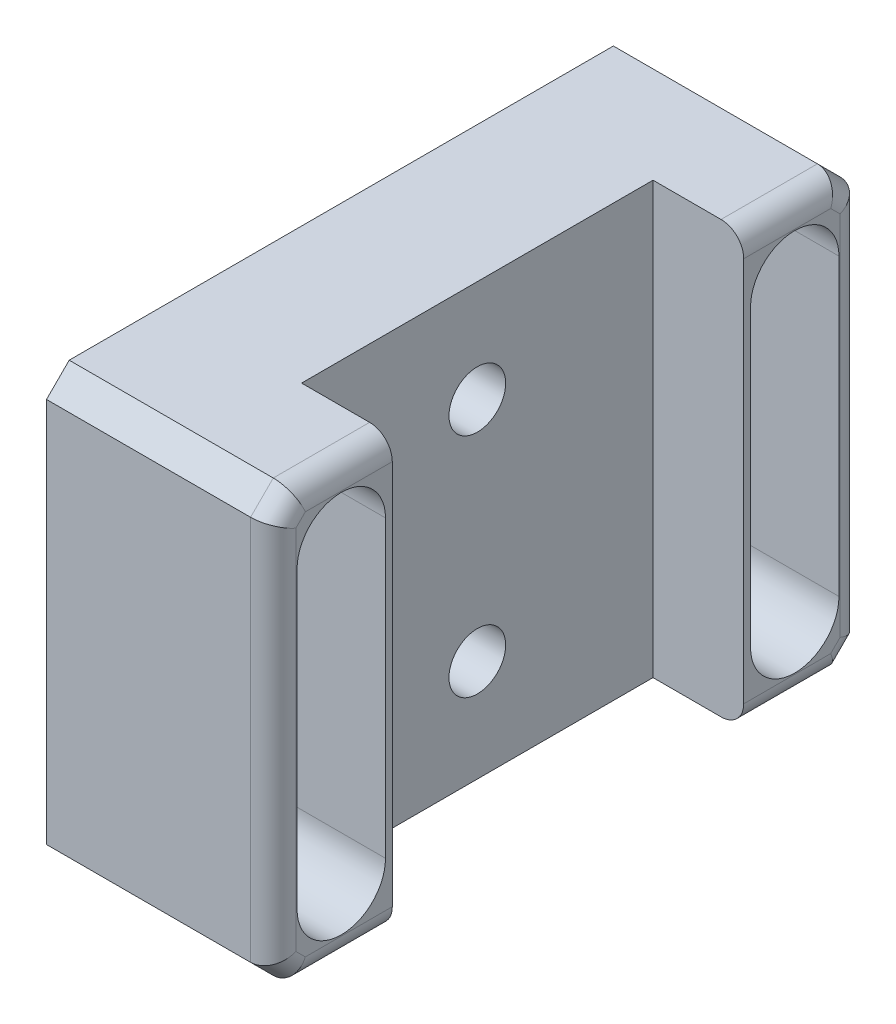
from build123d import *

# Parameters (mm, degrees)
SKETCH_1_W          = 26
SKETCH_1_H          = 19
EXTRUDE_1_DEPTH     = 10
SKETCH_2_W          = 15.5
SKETCH_2_H          = 19
CUT_EXTRUDE_1_DEPTH = 4
CUT_EXTRUDE_2_DEPTH = 4
CHAMFER_1_SIZE      = 1
FILLET_1_R          = 1
SKETCH_4_R          = 1.25
CUT_EXTRUDE_3_DEPTH = 18.182840277
CUT_EXTRUDE_4_DEPTH = 3


with BuildPart() as part:
    # Эскиз1 → Бобышка-Вытянуть1 (new body)
    with BuildSketch(Plane(origin=(0, 0, 0), x_dir=(0, 0, -1), z_dir=(1, 0, 0))):
        Rectangle(SKETCH_1_W, SKETCH_1_H)
        with BuildLine():
            Line((-8.75, 6.5), (-8.75, -6.5))
            ThreePointArc((-8.75, -6.5), (-10, -7.75), (-11.25, -6.5))
            Line((-11.25, -6.5), (-11.25, 6.5))
            ThreePointArc((-11.25, 6.5), (-10, 7.75), (-8.75, 6.5))
        make_face(mode=Mode.SUBTRACT)
        with BuildLine():
            Line((8.75, 6.5), (8.75, -6.5))
            ThreePointArc((8.75, -6.5), (10, -7.75), (11.25, -6.5))
            Line((11.25, -6.5), (11.25, 6.5))
            ThreePointArc((11.25, 6.5), (10, 7.75), (8.75, 6.5))
        make_face(mode=Mode.SUBTRACT)
    extrude(amount=EXTRUDE_1_DEPTH)

    # Эскиз2 → Вырез-Вытянуть1 (cut)
    with BuildSketch(Plane(origin=(10, 0, 0), x_dir=(0, 0, -1), z_dir=(1, 0, 0))):
        Rectangle(SKETCH_2_W, SKETCH_2_H)
    extrude(amount=-CUT_EXTRUDE_1_DEPTH, mode=Mode.SUBTRACT)

    # Эскиз3 → Вырез-Вытянуть2 (cut)
    with BuildSketch(Plane(origin=(10, 0, 0), x_dir=(0, 0, -1), z_dir=(1, 0, 0))):
        with BuildLine():
            Line((-11.95, -6.5), (-11.95, 6.5))
            ThreePointArc((-11.95, 6.5), (-10, 8.45), (-8.05, 6.5))
            Line((-8.05, 6.5), (-8.05, -6.5))
            ThreePointArc((-8.05, -6.5), (-10, -8.45), (-11.95, -6.5))
        make_face()
        with BuildLine():
            Line((11.95, -6.5), (11.95, 6.5))
            ThreePointArc((11.95, 6.5), (10, 8.45), (8.05, 6.5))
            Line((8.05, 6.5), (8.05, -6.5))
            ThreePointArc((8.05, -6.5), (10, -8.45), (11.95, -6.5))
        make_face()
    extrude(amount=-CUT_EXTRUDE_2_DEPTH, mode=Mode.SUBTRACT)

    # Фаска1
    chamfer_1_edges = [part.edges().sort_by_distance(p)[0] for p in [
        (5, 9.5, -13),
        (5, -9.5, -13),
        (5, -9.5, 13),
        (5, 9.5, 13),
    ]]
    chamfer(chamfer_1_edges, length=CHAMFER_1_SIZE)

    # Скругление1
    fillet_1_edges = [part.edges().sort_by_distance(p)[0] for p in [
        (10, 9, 12.5),
        (10, -9, 12.5),
        (10, -9, -12.5),
        (10, -9.5, -9.875),
        (10, 0, -13),
        (10, 9, -12.5),
        (10, 9.5, -9.875),
        (10, -9.5, 9.875),
        (10, 9.5, 9.875),
        (10, 0, 13),
    ]]
    fillet(fillet_1_edges, radius=FILLET_1_R)

    # Эскиз4 → Вырез-Вытянуть3 (cut, through all)
    with BuildSketch(Plane(origin=(6, 0, 0), x_dir=(0, 0, -1), z_dir=(1, 0, 0))):
        with Locations((0, 5)):
            Circle(SKETCH_4_R)
        with Locations((0, -5)):
            Circle(SKETCH_4_R)
    extrude(amount=-CUT_EXTRUDE_3_DEPTH, mode=Mode.SUBTRACT)

    # Эскиз5 → Вырез-Вытянуть4 (cut)
    with BuildSketch(Plane.ZY):
        Polygon((1.169134295, 2.975), (2.33826859, 5), (1.169134295, 7.025), (-1.169134295, 7.025), (-2.33826859, 5), (-1.169134295, 2.975), align=None)
        Polygon((1.169134295, -7.025), (2.33826859, -5), (1.169134295, -2.975), (-1.169134295, -2.975), (-2.33826859, -5), (-1.169134295, -7.025), align=None)
    extrude(amount=-CUT_EXTRUDE_4_DEPTH, mode=Mode.SUBTRACT)


solid = part.part
